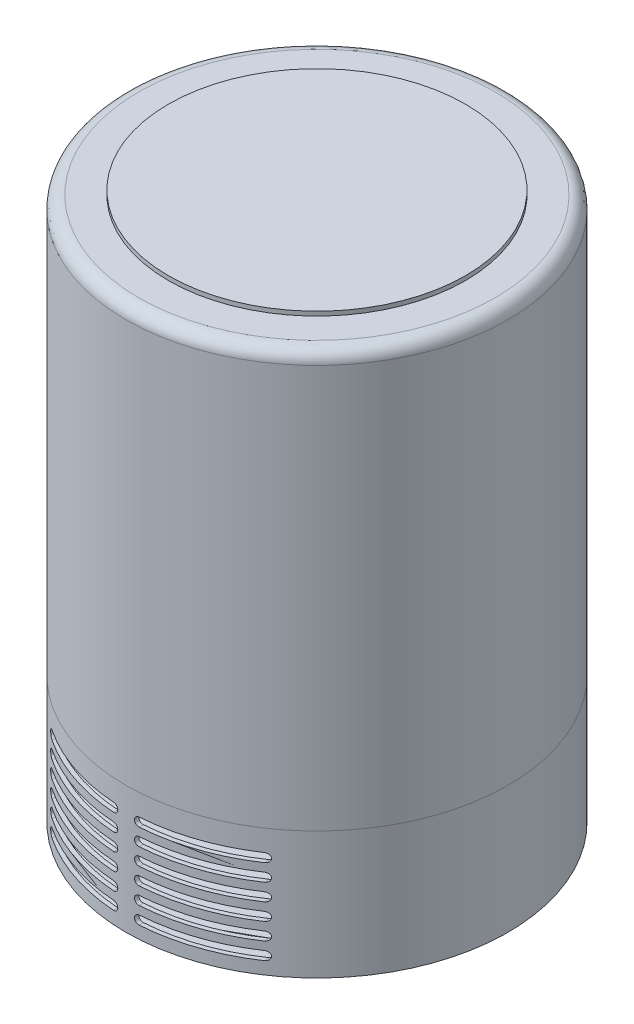
from build123d import *

# Parameters (mm, degrees)
SKETCH1_R           = 45
BOSS_EXTRUDE1_DEPTH = 98
FILLET1_R           = 3
SKETCH2_R           = 44
CUT_EXTRUDE1_DEPTH  = 97
SKETCH5_R           = 45
BOSS_EXTRUDE6_DEPTH = 30
CUT_EXTRUDE2_START  = -29
SKETCH6_R           = 44
CUT_EXTRUDE2_DEPTH  = 29
SKETCH7_R           = 35
BOSS_EXTRUDE7_DEPTH = 1
CUT_EXTRUDE3_START  = -39
SKETCH8_W           = 7
SKETCH8_H           = 3.5
CUT_EXTRUDE3_DEPTH  = 79.690271514
CUT_EXTRUDE5_START  = -36
CUT_EXTRUDE5_DEPTH  = 10
CUT_EXTRUDE6_START  = 46
CUT_EXTRUDE6_DEPTH  = 10


with BuildPart() as part:
    # Sketch1 → Boss-Extrude1 (new body)
    with BuildSketch(Plane(origin=(0, 0, 0), x_dir=(1, 0, 0), z_dir=(0, 1, 0))):
        Circle(SKETCH1_R)
    extrude(amount=BOSS_EXTRUDE1_DEPTH)

    # Fillet1
    fillet1_edges = [part.edges().sort_by_distance(p)[0] for p in [
        (-45, 98, 0),
    ]]
    fillet(fillet1_edges, radius=FILLET1_R)

    # Sketch2 → Cut-Extrude1 (cut)
    with BuildSketch(Plane.XZ):
        Circle(SKETCH2_R)
    extrude(amount=-CUT_EXTRUDE1_DEPTH, mode=Mode.SUBTRACT)

    # Sketch7 → Boss-Extrude7 (add)
    with BuildSketch(Plane(origin=(0, 98, 0), x_dir=(1, 0, 0), z_dir=(0, 1, 0))):
        Circle(SKETCH7_R)
    extrude(amount=BOSS_EXTRUDE7_DEPTH)


with BuildPart() as body_2:
    # Sketch5 → Boss-Extrude6 (new body)
    with BuildSketch(Plane(origin=(0, 0, 0), x_dir=(1, 0, 0), z_dir=(0, 1, 0))):
        Circle(SKETCH5_R)
    extrude(amount=-BOSS_EXTRUDE6_DEPTH)

    # Sketch6 → Cut-Extrude2 (cut)
    with BuildSketch(Plane(origin=(0, 0, 0), x_dir=(1, 0, 0), z_dir=(0, 1, 0)).offset(CUT_EXTRUDE2_START)):
        Circle(SKETCH6_R)
    extrude(amount=CUT_EXTRUDE2_DEPTH, mode=Mode.SUBTRACT)

    # Sketch8 → Cut-Extrude3 (cut, through all)
    with BuildSketch(Plane(origin=(0, 0, 0), x_dir=(0, 0, -1), z_dir=(1, 0, 0)).offset(CUT_EXTRUDE3_START)):
        with Locations((0, -15)):
            Rectangle(SKETCH8_W, SKETCH8_H)
    extrude(amount=-CUT_EXTRUDE3_DEPTH, mode=Mode.SUBTRACT)

    # Sketch10 → Cut-Extrude5 (cut)
    with BuildSketch(Plane.XY.offset(CUT_EXTRUDE5_START)):
        with BuildLine():
            Line((25, -5), (3, -5))
            ThreePointArc((3, -5), (1.971196539, -6.028803461), (3, -7.057606922))
            Line((3, -7.057606922), (25, -7.057606922))
            ThreePointArc((25, -7.057606922), (26.028803461, -6.028803461), (25, -5))
        make_face()
        with BuildLine():
            Line((-25, -5), (-3, -5))
            ThreePointArc((-3, -5), (-1.971196539, -6.028803461), (-3, -7.057606922))
            Line((-3, -7.057606922), (-25, -7.057606922))
            ThreePointArc((-25, -7.057606922), (-26.028803461, -6.028803461), (-25, -5))
        make_face()
        with BuildLine():
            Line((-25, -9), (-3, -9))
            ThreePointArc((-3, -9), (-1.971196539, -10.028803461), (-3, -11.057606922))
            Line((-3, -11.057606922), (-25, -11.057606922))
            ThreePointArc((-25, -11.057606922), (-26.028803461, -10.028803461), (-25, -9))
        make_face()
        with BuildLine():
            Line((25, -9), (3, -9))
            ThreePointArc((3, -9), (1.971196539, -10.028803461), (3, -11.057606922))
            Line((3, -11.057606922), (25, -11.057606922))
            ThreePointArc((25, -11.057606922), (26.028803461, -10.028803461), (25, -9))
        make_face()
        with BuildLine():
            Line((-25, -13), (-3, -13))
            ThreePointArc((-3, -13), (-1.971196539, -14.028803461), (-3, -15.057606922))
            Line((-3, -15.057606922), (-25, -15.057606922))
            ThreePointArc((-25, -15.057606922), (-26.028803461, -14.028803461), (-25, -13))
        make_face()
        with BuildLine():
            Line((25, -13), (3, -13))
            ThreePointArc((3, -13), (1.971196539, -14.028803461), (3, -15.057606922))
            Line((3, -15.057606922), (25, -15.057606922))
            ThreePointArc((25, -15.057606922), (26.028803461, -14.028803461), (25, -13))
        make_face()
        with BuildLine():
            Line((-25, -17), (-3, -17))
            ThreePointArc((-3, -17), (-1.971196539, -18.028803461), (-3, -19.057606922))
            Line((-3, -19.057606922), (-25, -19.057606922))
            ThreePointArc((-25, -19.057606922), (-26.028803461, -18.028803461), (-25, -17))
        make_face()
        with BuildLine():
            Line((25, -17), (3, -17))
            ThreePointArc((3, -17), (1.971196539, -18.028803461), (3, -19.057606922))
            Line((3, -19.057606922), (25, -19.057606922))
            ThreePointArc((25, -19.057606922), (26.028803461, -18.028803461), (25, -17))
        make_face()
        with BuildLine():
            Line((-25, -21), (-3, -21))
            ThreePointArc((-3, -21), (-1.971196539, -22.028803461), (-3, -23.057606922))
            Line((-3, -23.057606922), (-25, -23.057606922))
            ThreePointArc((-25, -23.057606922), (-26.028803461, -22.028803461), (-25, -21))
        make_face()
        with BuildLine():
            Line((25, -21), (3, -21))
            ThreePointArc((3, -21), (1.971196539, -22.028803461), (3, -23.057606922))
            Line((3, -23.057606922), (25, -23.057606922))
            ThreePointArc((25, -23.057606922), (26.028803461, -22.028803461), (25, -21))
        make_face()
        with BuildLine():
            Line((-25, -25), (-3, -25))
            ThreePointArc((-3, -25), (-1.971196539, -26.028803461), (-3, -27.057606922))
            Line((-3, -27.057606922), (-25, -27.057606922))
            ThreePointArc((-25, -27.057606922), (-26.028803461, -26.028803461), (-25, -25))
        make_face()
        with BuildLine():
            Line((25, -25), (3, -25))
            ThreePointArc((3, -25), (1.971196539, -26.028803461), (3, -27.057606922))
            Line((3, -27.057606922), (25, -27.057606922))
            ThreePointArc((25, -27.057606922), (26.028803461, -26.028803461), (25, -25))
        make_face()
    extrude(amount=-CUT_EXTRUDE5_DEPTH, mode=Mode.SUBTRACT)

    # Sketch12 → Cut-Extrude6 (cut)
    with BuildSketch(Plane.XY.offset(CUT_EXTRUDE6_START)):
        with BuildLine():
            Line((25, -5), (3, -5))
            ThreePointArc((3, -5), (1.971196539, -6.028803461), (3, -7.057606922))
            Line((3, -7.057606922), (25, -7.057606922))
            ThreePointArc((25, -7.057606922), (26.028803461, -6.028803461), (25, -5))
        make_face()
        with BuildLine():
            Line((-25, -5), (-3, -5))
            ThreePointArc((-3, -5), (-1.971196539, -6.028803461), (-3, -7.057606922))
            Line((-3, -7.057606922), (-25, -7.057606922))
            ThreePointArc((-25, -7.057606922), (-26.028803461, -6.028803461), (-25, -5))
        make_face()
        with BuildLine():
            Line((-25, -9), (-3, -9))
            ThreePointArc((-3, -9), (-1.971196539, -10.028803461), (-3, -11.057606922))
            Line((-3, -11.057606922), (-25, -11.057606922))
            ThreePointArc((-25, -11.057606922), (-26.028803461, -10.028803461), (-25, -9))
        make_face()
        with BuildLine():
            Line((25, -9), (3, -9))
            ThreePointArc((3, -9), (1.971196539, -10.028803461), (3, -11.057606922))
            Line((3, -11.057606922), (25, -11.057606922))
            ThreePointArc((25, -11.057606922), (26.028803461, -10.028803461), (25, -9))
        make_face()
        with BuildLine():
            Line((-25, -13), (-3, -13))
            ThreePointArc((-3, -13), (-1.971196539, -14.028803461), (-3, -15.057606922))
            Line((-3, -15.057606922), (-25, -15.057606922))
            ThreePointArc((-25, -15.057606922), (-26.028803461, -14.028803461), (-25, -13))
        make_face()
        with BuildLine():
            Line((25, -13), (3, -13))
            ThreePointArc((3, -13), (1.971196539, -14.028803461), (3, -15.057606922))
            Line((3, -15.057606922), (25, -15.057606922))
            ThreePointArc((25, -15.057606922), (26.028803461, -14.028803461), (25, -13))
        make_face()
        with BuildLine():
            Line((-25, -17), (-3, -17))
            ThreePointArc((-3, -17), (-1.971196539, -18.028803461), (-3, -19.057606922))
            Line((-3, -19.057606922), (-25, -19.057606922))
            ThreePointArc((-25, -19.057606922), (-26.028803461, -18.028803461), (-25, -17))
        make_face()
        with BuildLine():
            Line((25, -17), (3, -17))
            ThreePointArc((3, -17), (1.971196539, -18.028803461), (3, -19.057606922))
            Line((3, -19.057606922), (25, -19.057606922))
            ThreePointArc((25, -19.057606922), (26.028803461, -18.028803461), (25, -17))
        make_face()
        with BuildLine():
            Line((-25, -21), (-3, -21))
            ThreePointArc((-3, -21), (-1.971196539, -22.028803461), (-3, -23.057606922))
            Line((-3, -23.057606922), (-25, -23.057606922))
            ThreePointArc((-25, -23.057606922), (-26.028803461, -22.028803461), (-25, -21))
        make_face()
        with BuildLine():
            Line((25, -21), (3, -21))
            ThreePointArc((3, -21), (1.971196539, -22.028803461), (3, -23.057606922))
            Line((3, -23.057606922), (25, -23.057606922))
            ThreePointArc((25, -23.057606922), (26.028803461, -22.028803461), (25, -21))
        make_face()
        with BuildLine():
            Line((-25, -25), (-3, -25))
            ThreePointArc((-3, -25), (-1.971196539, -26.028803461), (-3, -27.057606922))
            Line((-3, -27.057606922), (-25, -27.057606922))
            ThreePointArc((-25, -27.057606922), (-26.028803461, -26.028803461), (-25, -25))
        make_face()
        with BuildLine():
            Line((25, -25), (3, -25))
            ThreePointArc((3, -25), (1.971196539, -26.028803461), (3, -27.057606922))
            Line((3, -27.057606922), (25, -27.057606922))
            ThreePointArc((25, -27.057606922), (26.028803461, -26.028803461), (25, -25))
        make_face()
    extrude(amount=-CUT_EXTRUDE6_DEPTH, mode=Mode.SUBTRACT)


solid = Compound([part.part, body_2.part])
